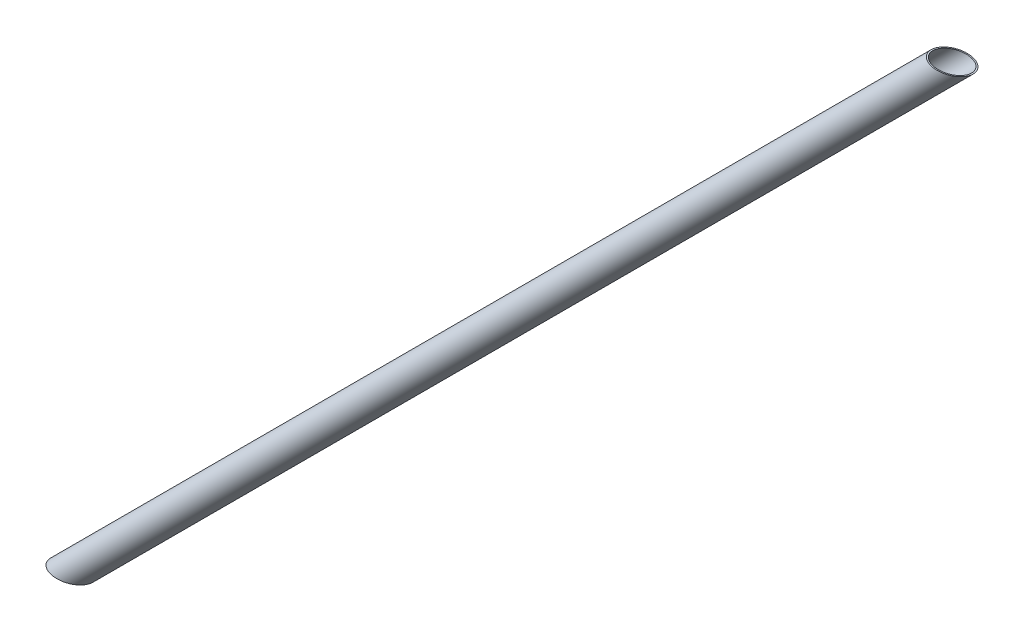
from build123d import *

# Parameters (mm, degrees)
CORTAR_EXTRUIR1_DEPTH      = 2173.26884775
CORTAR_EXTRUIR1_DEPTH_BACK = 2173.26884775


with BuildPart() as part:
    # Croquis1 → Revolución1 (revolve)
    with BuildSketch(Plane.XY):
        Polygon((0, -35.921024484), (-1.414213561, -34.506810923), (1534.506810922, 1501.414213562), (1535.921024484, 1500), align=None)
    revolve(axis=Axis((1517.960512242, 1517.960512242, 0), (-0.7071067811865475, -0.7071067811865476, 0)))

    # Croquis2 → Cortar-Extruir1 (cut, two sides: drawn at the far end of the back side and taken through both)
    with BuildSketch(Plane.XY.offset(-CORTAR_EXTRUIR1_DEPTH_BACK)):
        Polygon((-35.921024484, 0), (35.921024484, 0), (0, -35.921024484), align=None)
        Polygon((1535.921024484, 1500), (1464.078975516, 1500), (1500, 1535.921024484), align=None)
    extrude(amount=CORTAR_EXTRUIR1_DEPTH + CORTAR_EXTRUIR1_DEPTH_BACK, mode=Mode.SUBTRACT)


solid = part.part
